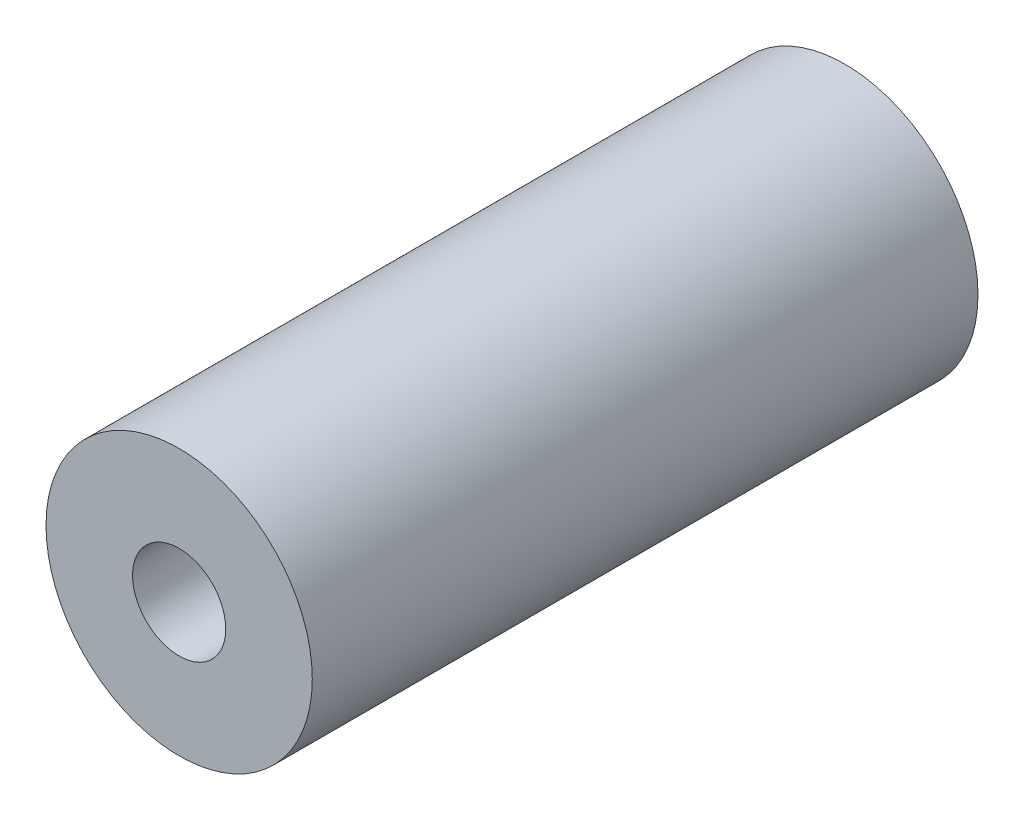
from build123d import *

# Parameters (mm, degrees)
SKETCH1_R           = 6
SKETCH1_R_2         = 2.1
BOSS_EXTRUDE1_DEPTH = 30


with BuildPart() as part:
    # Sketch1 → Boss-Extrude1 (new body)
    with BuildSketch(Plane.XY):
        Circle(SKETCH1_R)
        Circle(SKETCH1_R_2, mode=Mode.SUBTRACT)
    extrude(amount=BOSS_EXTRUDE1_DEPTH)


solid = part.part
